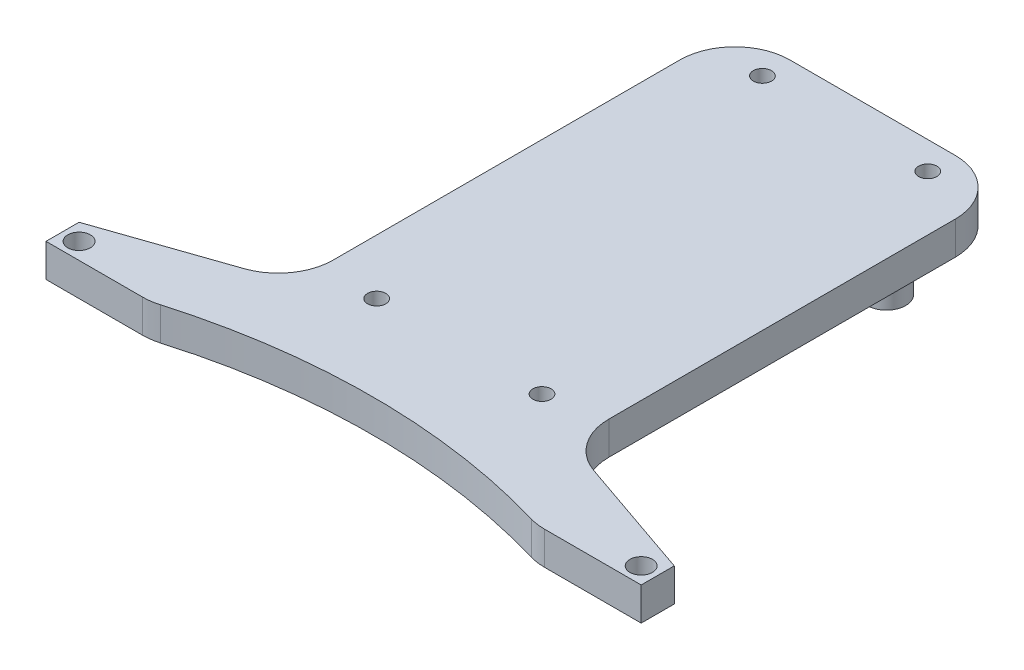
from build123d import *

# Parameters (mm, degrees)
SKETCH1_R               = 2.05
SKETCH1_R_2             = 1.65
BOSS_EXTRUDE1_DEPTH     = 6
CUT_EXTRUDE1_DEPTH      = 145.623649518
CUT_EXTRUDE1_DEPTH_BACK = 145.623649518
FILLET1_R               = 10
SKETCH3_R               = 3.5
BOSS_EXTRUDE2_DEPTH     = 7.1
CHAMFER1_SIZE           = 2


with BuildPart() as part:
    # Sketch1 → Boss-Extrude1 (new body)
    with BuildSketch(Plane(origin=(0, 0, 0), x_dir=(1, 0, 0), z_dir=(0, 1, 0))):
        Polygon((0, 0), (108, 0), (108, 6), (79, 16), (79, 96), (29, 96), (29, 16), (0, 6), align=None)
        with Locations((3, 3)):
            Circle(SKETCH1_R, mode=Mode.SUBTRACT)
        with Locations((105, 3)):
            Circle(SKETCH1_R, mode=Mode.SUBTRACT)
        with Locations((39, 91)):
            Circle(SKETCH1_R_2, mode=Mode.SUBTRACT)
        with Locations((69, 91)):
            Circle(SKETCH1_R_2, mode=Mode.SUBTRACT)
        with Locations((39, 21)):
            Circle(SKETCH1_R_2, mode=Mode.SUBTRACT)
        with Locations((69, 21)):
            Circle(SKETCH1_R_2, mode=Mode.SUBTRACT)
    extrude(amount=BOSS_EXTRUDE1_DEPTH)

    # Sketch2 → Cut-Extrude1 (cut, two sides: drawn at the far end of the back side and taken through both)
    with BuildSketch(Plane(origin=(0, 6, 0), x_dir=(1, 0, 0), z_dir=(0, 1, 0)).offset(-CUT_EXTRUDE1_DEPTH_BACK)):
        with BuildLine():
            Line((19, 0), (89, 0))
            ThreePointArc((89, 0), (54, 5.217597168), (19, 0))
        make_face()
    extrude(amount=CUT_EXTRUDE1_DEPTH + CUT_EXTRUDE1_DEPTH_BACK, mode=Mode.SUBTRACT)

    # Fillet1
    fillet1_edges = [part.edges().sort_by_distance(p)[0] for p in [
        (79, 3, -96),
        (29, 3, -96),
        (89, 3, 0),
        (19, 3, 0),
        (79, 3, -16),
        (29, 3, -16),
    ]]
    fillet(fillet1_edges, radius=FILLET1_R)

    # Sketch3 → Boss-Extrude2 (add)
    with BuildSketch(Plane.XZ):
        with Locations((36.5, -81)):
            Circle(SKETCH3_R)
        with Locations((71.5, -81)):
            Circle(SKETCH3_R)
    extrude(amount=BOSS_EXTRUDE2_DEPTH)

    # Chamfer1
    chamfer1_edges = [part.edges().sort_by_distance(p)[0] for p in [
        (68, 0, -81),
        (33, 0, -81),
    ]]
    chamfer(chamfer1_edges, length=CHAMFER1_SIZE)


solid = part.part
